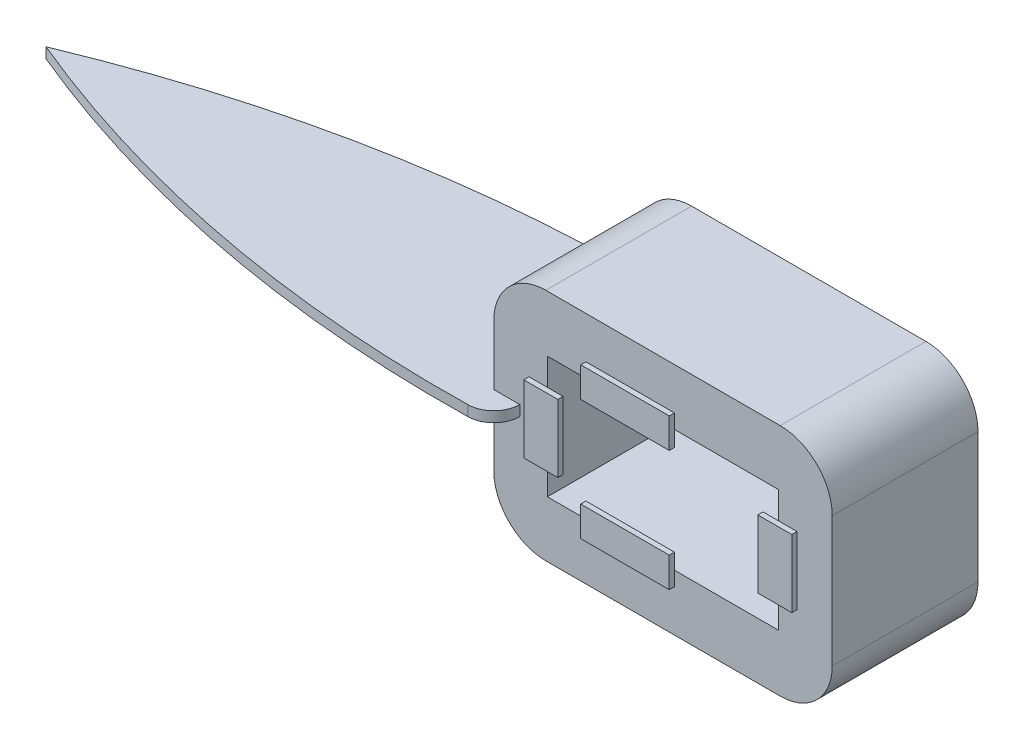
from build123d import *

# Parameters (mm, degrees)
SKETCH_1_W           = 65
SKETCH_1_H           = 45
EXTRUDE_1_DEPTH      = 28
SKETCH_2_W           = 44.4
SKETCH_2_H           = 23.4
CUT_EXTRUDE_1_DEPTH  = 39
FILLET_1_R           = 10
FILLET_2_R           = 10
FILLET_3_R           = 10
FILLET_4_R           = 10
EXTRUDE_6_DEPTH      = 1
EXTRUDE_6_2_DEPTH    = 1
EXTRUDE_6_3_DEPTH    = 1
SKETCH_10_W          = 17
SKETCH_10_H          = 5.754584259
EXTRUDE_6_4_DEPTH    = 1
SKETCH_20_W          = 5.002637397
SKETCH_20_H          = 2
EXTRUDE_7_DEPTH      = 5
SKETCH_21_W          = 5.00232547
SKETCH_21_H          = 2
EXTRUDE_8_DEPTH      = 5
EXTRUDE_9_DEPTH      = 1
EXTRUDE_9_DEPTH_BACK = 1
FILLET_5_R           = 5
FILLET_6_R           = 5


with BuildPart() as part:
    # 草圖1 → 填料-伸長1 (new body)
    with BuildSketch(Plane.XY):
        with Locations((-27.434655272, 0)):
            Rectangle(SKETCH_1_W, SKETCH_1_H)
    extrude(amount=EXTRUDE_1_DEPTH)

    # 草圖2 → 除料-伸長1 (cut)
    with BuildSketch(Plane.XY):
        with Locations((-27.434655272, 0)):
            Rectangle(SKETCH_2_W, SKETCH_2_H)
    extrude(amount=CUT_EXTRUDE_1_DEPTH, mode=Mode.SUBTRACT)

    # 圓角1
    fillet_1_edges = [part.edges().sort_by_distance(p)[0] for p in [
        (-59.934655272, -22.5, 14),
    ]]
    fillet(fillet_1_edges, radius=FILLET_1_R)

    # 圓角2
    fillet_2_edges = [part.edges().sort_by_distance(p)[0] for p in [
        (-59.934655272, 22.5, 14),
    ]]
    fillet(fillet_2_edges, radius=FILLET_2_R)

    # 圓角3
    fillet_3_edges = [part.edges().sort_by_distance(p)[0] for p in [
        (5.065344728, 22.5, 14),
    ]]
    fillet(fillet_3_edges, radius=FILLET_3_R)

    # 圓角4
    fillet_4_edges = [part.edges().sort_by_distance(p)[0] for p in [
        (5.065344728, -22.5, 14),
    ]]
    fillet(fillet_4_edges, radius=FILLET_4_R)

    # 草圖20 → 填料-伸長7 (add)
    with BuildSketch(Plane.XY.offset(28)):
        with Locations((-57.433336574, 0)):
            Rectangle(SKETCH_20_W, SKETCH_20_H)
    extrude(amount=EXTRUDE_7_DEPTH)

    # 草圖21 → 填料-伸長8 (add)
    with BuildSketch(Plane(origin=(0, 0, 0), x_dir=(-1, 0, 0), z_dir=(0, 0, -1))):
        with Locations((57.433492537, 0)):
            Rectangle(SKETCH_21_W, SKETCH_21_H)
    extrude(amount=EXTRUDE_8_DEPTH)

    # 草圖22 → 填料-伸長9 (add, two sides: drawn at the far end of the back side and taken through both)
    with BuildSketch(Plane(origin=(0, 0, 0), x_dir=(1, 0, 0), z_dir=(0, 1, 0)).offset(-EXTRUDE_9_DEPTH_BACK)):
        with BuildLine():
            Line((-59.934655272, 5), (-59.934655272, -33))
            ThreePointArc((-59.934655272, -33), (-110.92327451, -28.70325915), (-159.934655272, -14))
            ThreePointArc((-159.934655272, -14), (-110.92327451, 0.70325915), (-59.934655272, 5))
        make_face()
    extrude(amount=EXTRUDE_9_DEPTH + EXTRUDE_9_DEPTH_BACK)

    # 圓角5
    fillet_5_edges = [part.edges().sort_by_distance(p)[0] for p in [
        (-54.932329802, 0, -5),
    ]]
    fillet(fillet_5_edges, radius=FILLET_5_R - 0.0001)  # a hair under: the kernel refuses the full size

    # 圓角6
    fillet_6_edges = [part.edges().sort_by_distance(p)[0] for p in [
        (-54.932017875, 0, 33),
    ]]
    fillet(fillet_6_edges, radius=FILLET_6_R - 0.0001)  # a hair under: the kernel refuses the full size


with BuildPart() as body_2:
    # 草圖10 → 填料-伸長6 (new body)
    with BuildSketch(Plane.XY.offset(29)):
        Polygon((-49.634655272, 6.5), (-53.165057103, 6.5), (-53.165057103, -6.5), (-46.634655272, -6.5), (-46.634655272, 6.5), align=None)
    extrude(amount=-EXTRUDE_6_DEPTH)


with BuildPart() as body_3:
    # 草圖10 → Extrude 6 2 (new body)
    with BuildSketch(Plane.XY.offset(29)):
        Polygon((-42.234655272, -11.7), (-42.234655272, -8.7), (-25.234655272, -8.7), (-25.234655272, -14.454584259), (-42.234655272, -14.454584259), align=None)
    extrude(amount=-EXTRUDE_6_2_DEPTH)


with BuildPart() as body_4:
    # 草圖10 → Extrude 6 3 (new body)
    with BuildSketch(Plane.XY.offset(29)):
        Polygon((-8.234655272, 6.5), (-8.234655272, -6.5), (-5.234655272, -6.5), (-1.70425344, -6.5), (-1.70425344, 6.5), align=None)
    extrude(amount=-EXTRUDE_6_3_DEPTH)


with BuildPart() as body_5:
    # 草圖10 → Extrude 6 4 (new body)
    with BuildSketch(Plane.XY.offset(29)):
        with Locations((-33.734655272, 11.57729213)):
            Rectangle(SKETCH_10_W, SKETCH_10_H)
    extrude(amount=-EXTRUDE_6_4_DEPTH)


solid = Compound([part.part, body_2.part, body_3.part, body_4.part, body_5.part])
